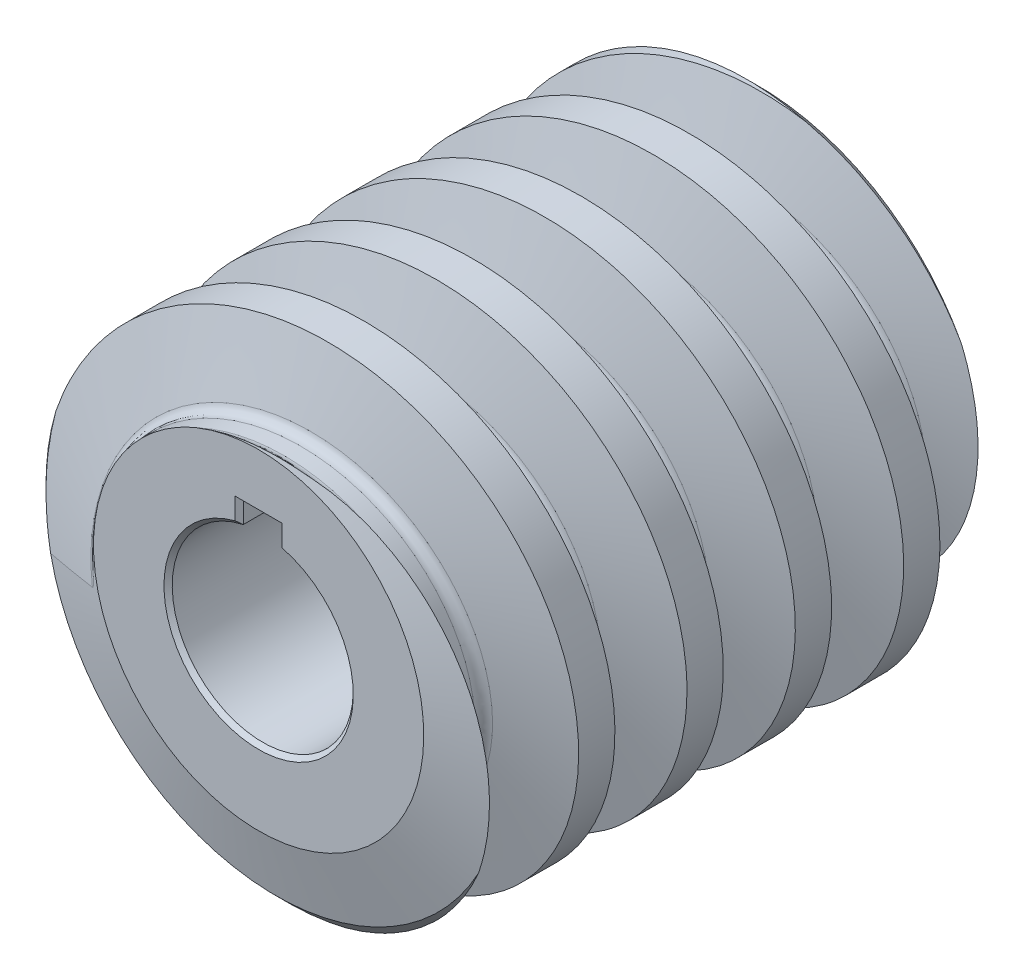
from build123d import *

# Parameters (mm, degrees)
TOOTHCUTWORM01_PITCH    = 13.2994089
BOREREVOLVESKETCH_W     = 63.5
BOREREVOLVESKETCH_H     = 11.1125
KEYWAY_DEPTH            = 53.872932612
KEYWAY_DEPTH_BACK       = 53.872932612
KEYWAYSKETCH_W          = 4.7625
KEYWAYSKETCH_H          = 3.175
SKETCH7_OUTSIDE_W       = 101.374
SKETCH7_OUTSIDE_H       = 101.374
SKETCH7_OUTSIDE_R       = 20.2692
CUT_EXTRUDE2_DEPTH      = 2.54
CUT_EXTRUDE2_DRAFT      = -75
MIRROR1_COPY_1_SKETCH_W = 101.374
MIRROR1_COPY_1_SKETCH_H = 101.374
MIRROR1_COPY_1_SKETCH_R = 20.2692
MIRROR1_COPY_1_DEPTH    = 2.54
MIRROR1_COPY_1_DRAFT    = -75
CHAMFER1_SIZE           = 0.508


with BuildPart() as part:
    # SketchRevolveWorm01 → Worm01 (revolve)
    with BuildSketch(Plane(origin=(0, 0, 0), x_dir=(0, 0, -1), z_dir=(1, 0, 0)), mode=Mode.PRIVATE) as worm01_sk:
        Polygon((31.75, 0), (31.75, 26.102733333), (28.2194, 29.633333333), (-28.2194, 29.633333333), (-31.75, 26.102733333), (-31.75, 0), align=None)
    revolve(worm01_sk.sketch.rotate(Axis((0, 0, 0), (0, 0, -1)), 90), axis=Axis((0, 0, 0), (0, 0, -1)))

    # ToothCutWorm01: the profile of SketchToothWorm01 screwed along a right-hand helix of 6 turns, 18 arcs to a turn; built about Z, then put on its axis
    toothcutworm01_z = Axis((0, 0, 0), (0, 0, 1))
    toothcutworm01_corners = [(30.691666667, 0, 4.698323737), (21.220138953, 0, 2.239953944), (20.2692, 0, 1.010685849), (20.2692, 0, -1.010685849), (21.220138953, 0, -2.239953944), (30.691666667, 0, -4.698323737)]
    with BuildLine(mode=Mode.PRIVATE) as toothcutworm01_profile:
        Line(toothcutworm01_corners[0], toothcutworm01_corners[1])
        Line(toothcutworm01_corners[2], toothcutworm01_corners[3])
        Line(toothcutworm01_corners[4], toothcutworm01_corners[5])
        Line(toothcutworm01_corners[5], toothcutworm01_corners[0])
        ThreePointArc((21.220138953, 0, 2.239953944), (20.534683318, 0, 1.787761286), (20.2692, 0, 1.010685849))
        ThreePointArc((20.2692, 0, -1.010685849), (20.534683318, 0, -1.787761286), (21.220138953, 0, -2.239953944))
    toothcutworm01_cap = Face(toothcutworm01_profile.wire())
    toothcutworm01_arcs = [((21.220138953, 0, 2.239953944), (20.2692, 0, 1.993134247), (20.2692, 0, 1.010685849), (1, 0.7909580175607537, 1)), ((20.2692, 0, -1.010685849), (20.2692, 0, -1.993134247), (21.220138953, 0, -2.239953944), (1, 0.7909580175607479, 1))]  # start, shoulder, end, weights
    toothcutworm01_turn_angles = [0, 10, 20, 30, 40, 50, 60, 70, 80, 90, 100, 110, 120, 130, 140, 150, 160, 170, 180, 190, 200, 210, 220, 230, 240, 250, 260, 270, 280, 290, 300, 310, 320, 330, 340, 350, 360]
    toothcutworm01_turn_weights = [1, 0.984807753012208, 1, 0.984807753012208, 1, 0.984807753012208, 1, 0.984807753012208, 1, 0.984807753012208, 1, 0.984807753012208, 1, 0.984807753012208, 1, 0.984807753012208, 1, 0.984807753012208, 1, 0.984807753012208, 1, 0.984807753012208, 1, 0.984807753012208, 1, 0.984807753012208, 1, 0.984807753012208, 1, 0.984807753012208, 1, 0.984807753012208, 1, 0.984807753012208, 1, 0.984807753012208, 1]
    toothcutworm01_turn_rails = [Edge.make_bspline([Vector(p[0], p[1], 0).rotate(toothcutworm01_z, toothcutworm01_turn_angles[k]) / toothcutworm01_turn_weights[k] + Vector(0, 0, p[2] + TOOTHCUTWORM01_PITCH * toothcutworm01_turn_angles[k] / 360) for k in range(37)], [0, 0, 0, 1, 1, 2, 2, 3, 3, 4, 4, 5, 5, 6, 6, 7, 7, 8, 8, 9, 9, 10, 10, 11, 11, 12, 12, 13, 13, 14, 14, 15, 15, 16, 16, 17, 17, 18, 18, 18], 2, toothcutworm01_turn_weights) for p in toothcutworm01_corners]
    toothcutworm01_turn_sides = [*[Face.make_surface_from_curves(toothcutworm01_turn_rails[p[0]], toothcutworm01_turn_rails[p[1]]) for p in [(0, 1), (2, 3), (4, 5), (5, 0)]], *[Face.make_bezier_surface([[Vector(p[j][0], p[j][1], 0).rotate(toothcutworm01_z, toothcutworm01_turn_angles[2 * i + k]) / toothcutworm01_turn_weights[2 * i + k] + Vector(0, 0, p[j][2] + TOOTHCUTWORM01_PITCH * toothcutworm01_turn_angles[2 * i + k] / 360) for k in range(3)] for j in range(3)], [[p[3][j] * toothcutworm01_turn_weights[2 * i + k] for k in range(3)] for j in range(3)]) for p in toothcutworm01_arcs for i in range(18)]]
    toothcutworm01 = Plane(origin=(0, 0, 39.898226701), x_dir=(1, 0, 0), z_dir=(0, 0, -1)) * Solid(Shell([*[p.moved(Location((0, 0, TOOTHCUTWORM01_PITCH * i))) for i in range(6) for p in toothcutworm01_turn_sides], toothcutworm01_cap, toothcutworm01_cap.rotate(toothcutworm01_z, 2160).moved(Location((0, 0, TOOTHCUTWORM01_PITCH * 2160 / 360)))]))
    add(toothcutworm01, mode=Mode.SUBTRACT)

    # BoreRevolveSketch → BoreRevolveCut (revolve, cut)
    with BuildSketch(Plane(origin=(0, 0, 0), x_dir=(0, 0, -1), z_dir=(1, 0, 0)), mode=Mode.PRIVATE) as borerevolvecut_sk:
        with Locations((0, 5.55625)):
            Rectangle(BOREREVOLVESKETCH_W, BOREREVOLVESKETCH_H)
    revolve(borerevolvecut_sk.sketch.rotate(Axis((0, 0, 0), (0, 0, -1)), 90), axis=Axis((0, 0, 0), (0, 0, -1)), mode=Mode.SUBTRACT)

    # KeywaySketch → Keyway (cut, two sides: drawn at the far end of the back side and taken through both)
    with BuildSketch(Plane.XY.offset(-KEYWAY_DEPTH_BACK)):
        with Locations((0, 11.7856)):
            Rectangle(KEYWAYSKETCH_W, KEYWAYSKETCH_H)
    extrude(amount=KEYWAY_DEPTH + KEYWAY_DEPTH_BACK, mode=Mode.SUBTRACT)


with BuildPart() as cut_extrude2_tool:
    # Sketch7 outside → Cut-Extrude2 (with draft: the straight prism first)
    with BuildSketch(Plane.XY.offset(31.75)):
        Rectangle(SKETCH7_OUTSIDE_W, SKETCH7_OUTSIDE_H)
        Circle(SKETCH7_OUTSIDE_R, mode=Mode.SUBTRACT)
    extrude(amount=-CUT_EXTRUDE2_DEPTH)
    # Cut-Extrude2: the draft: its side faces are tilted about the plane it starts from
    cut_extrude2_sides = [cut_extrude2_tool.faces().sort_by_distance(p)[0] for p in [
        (0, -50.687, 30.48),
        (50.687, 0, 30.48),
        (0, 50.687, 30.48),
        (-50.687, 0, 30.48),
        (-20.2692, 0, 30.48),
    ]]
    draft(cut_extrude2_sides, Plane.XY.offset(31.75), CUT_EXTRUDE2_DRAFT)


with BuildPart() as part_1:
    add(part.part)

    # Cut-Extrude2: cut by cut_extrude2_tool
    add(cut_extrude2_tool.part, mode=Mode.SUBTRACT)


with BuildPart() as mirror1_copy_1_tool:
    # Mirror1 copy 1 sketch → Mirror1 copy 1 (with draft: the straight prism first)
    with BuildSketch(Plane(origin=(0, 0, -31.75), x_dir=(1, 0, 0), z_dir=(0, 0, -1))):
        Rectangle(MIRROR1_COPY_1_SKETCH_W, MIRROR1_COPY_1_SKETCH_H)
        Circle(MIRROR1_COPY_1_SKETCH_R, mode=Mode.SUBTRACT)
    extrude(amount=-MIRROR1_COPY_1_DEPTH)
    # Mirror1 copy 1: the draft: its side faces are tilted about the plane it starts from
    mirror1_copy_1_sides = [mirror1_copy_1_tool.faces().sort_by_distance(p)[0] for p in [
        (0, -50.687, -30.48),
        (50.687, 0, -30.48),
        (0, 50.687, -30.48),
        (-50.687, 0, -30.48),
        (-20.2692, 0, -30.48),
    ]]
    draft(mirror1_copy_1_sides, Plane(origin=(0, 0, -31.75), x_dir=(1, 0, 0), z_dir=(0, 0, -1)), MIRROR1_COPY_1_DRAFT)


with BuildPart() as part_2:
    add(part_1.part)

    # Mirror1 copy 1: cut by mirror1_copy_1_tool
    add(mirror1_copy_1_tool.part, mode=Mode.SUBTRACT)

    # Chamfer1
    chamfer1_edges = [part_2.edges().sort_by_distance(p)[0] for p in [
        (0, -11.1125, 31.75),
        (0, -11.1125, -31.75),
        (0, 13.3731, 31.75),
        (0, 13.3731, -31.75),
        (2.38125, 12.113734, -31.75),
        (2.38125, 12.113734, 31.75),
        (-2.38125, 12.113734, -31.75),
        (-2.38125, 12.113734, 31.75),
    ]]
    chamfer(chamfer1_edges, length=CHAMFER1_SIZE)


solid = part_2.part
